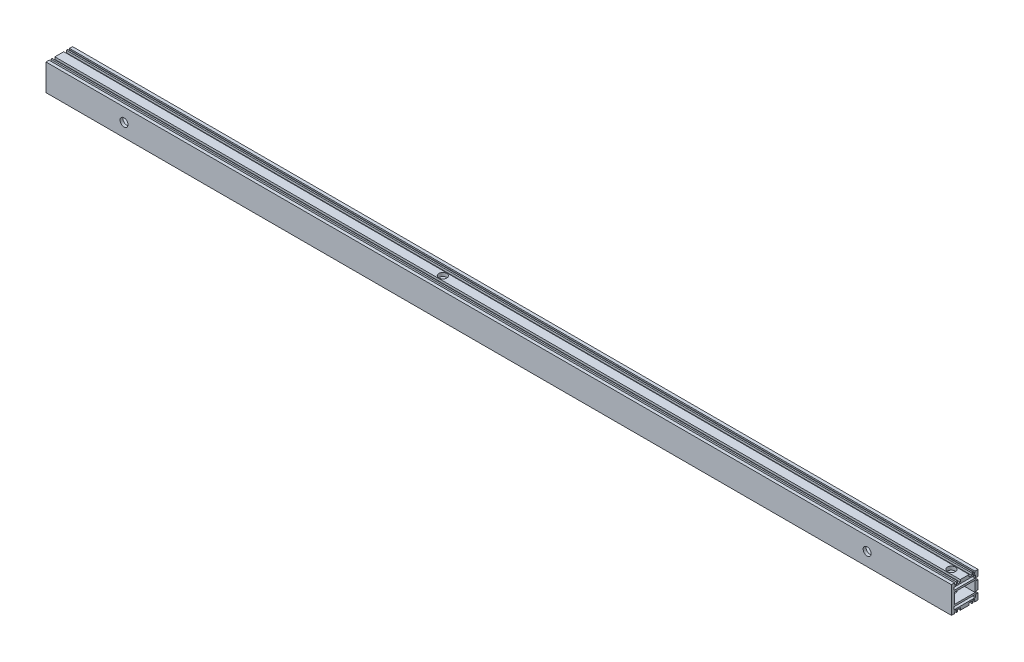
from build123d import *

# Parameters (mm, degrees)
SKETCH_1_W             = 23.5
SKETCH_1_H             = 12
EXTRUDE_1_DEPTH        = 510.5
HOLE_WIZARD_M6_1_D     = 5
HOLE_WIZARD_M6_1_DEPTH = 19
HOLE_WIZARD_M6_1_TIP   = 1.502151548
HOLE_WIZARD_M6_2_D     = 5
HOLE_WIZARD_M6_2_DEPTH = 19
HOLE_WIZARD_M6_2_TIP   = 1.502151548
HOLE_WIZARD_M6_3_D     = 5
HOLE_WIZARD_M6_3_DEPTH = 17
HOLE_WIZARD_M6_3_TIP   = 1.502151548
SKETCH_9_R             = 4.5
CUT_EXTRUDE_1_DEPTH    = 512.600674355
SKETCH_10_R            = 4.5
CUT_EXTRUDE_2_DEPTH    = 512.600674355
HOLE_WIZARD_M4_1_D     = 3.3
HOLE_WIZARD_M4_1_DEPTH = 11.5
HOLE_WIZARD_M4_1_TIP   = 0.991420021
HOLE_WIZARD_M4_2_D     = 3.3
HOLE_WIZARD_M4_2_DEPTH = 11.5
HOLE_WIZARD_M4_2_TIP   = 0.991420021


with BuildPart() as part:
    # 草图1 → 凸台-拉伸1 (new, symmetric)
    with BuildSketch(Plane(origin=(0, 0, 0), x_dir=(0, 0, -1), z_dir=(1, 0, 0))):
        Polygon((-11.5, 15), (-15, 15), (-15, -15), (-11.5, -15), (-11.5, -13.5), (-11, -13.5), (-11, -12), (-9.5, -12), (-9.5, -15), (-8, -15), (-8, -12.5), (-5, -12.5), (-5, -15), (5, -15), (5, -12.5), (8, -12.5), (8, -15), (9.5, -15), (9.5, -12), (11, -12), (11, -13.5), (11.5, -13.5), (11.5, -15), (15, -15), (15, -8), (12.5, -8), (12.5, -5), (15, -5), (15, 5), (12.5, 5), (12.5, 8), (15, 8), (15, 15), (11.5, 15), (11.5, 13.5), (11, 13.5), (11, 12), (9.5, 12), (9.5, 15), (8, 15), (8, 12.5), (5, 12.5), (5, 15), (-5, 15), (-5, 12.5), (-8, 12.5), (-8, 15), (-9.5, 15), (-9.5, 12), (-11, 12), (-11, 13.5), (-11.5, 13.5), align=None)
        with BuildLine():
            Line((12, -8.5), (12, -10.5))
            ThreePointArc((12, -10.5), (11.853553391, -10.853553391), (11.5, -11))
            Line((11.5, -11), (-11.5, -11))
            ThreePointArc((-11.5, -11), (-11.853553391, -10.853553391), (-12, -10.5))
            Line((-12, -10.5), (-12, -8.5))
            ThreePointArc((-12, -8.5), (-11.853553391, -8.146446609), (-11.5, -8))
            Line((-11.5, -8), (11.5, -8))
            ThreePointArc((11.5, -8), (11.853553391, -8.146446609), (12, -8.5))
        make_face(mode=Mode.SUBTRACT)
        Rectangle(SKETCH_1_W, SKETCH_1_H, mode=Mode.SUBTRACT)
        with BuildLine():
            ThreePointArc((-12, 10.5), (-11.853553391, 10.853553391), (-11.5, 11))
            Line((-11.5, 11), (11.5, 11))
            ThreePointArc((11.5, 11), (11.853553391, 10.853553391), (12, 10.5))
            Line((12, 10.5), (12, 8.5))
            ThreePointArc((12, 8.5), (11.853553391, 8.146446609), (11.5, 8))
            Line((11.5, 8), (-11.5, 8))
            ThreePointArc((-11.5, 8), (-11.853553391, 8.146446609), (-12, 8.5))
            Line((-12, 8.5), (-12, 10.5))
        make_face(mode=Mode.SUBTRACT)
    extrude(amount=EXTRUDE_1_DEPTH, both=True)

    # M6 螺纹孔1
    with Locations(Plane(origin=(0, -15, 0), x_dir=(-1, 0, 0), z_dir=(0, -1, 0))):
        with Locations((-460.5, 0), (-445.5, 0), (133, 0), (148, 0), (218, 0), (233, 0), (445.5, 0), (460.5, 0)):
            Hole(HOLE_WIZARD_M6_1_D / 2, depth=HOLE_WIZARD_M6_1_DEPTH)
            with Locations((0, 0, -(HOLE_WIZARD_M6_1_DEPTH + HOLE_WIZARD_M6_1_TIP / 2))):  # 118° drill point
                Cone(0, HOLE_WIZARD_M6_1_D / 2, HOLE_WIZARD_M6_1_TIP, mode=Mode.SUBTRACT)

    # M6 螺纹孔2
    with Locations(Plane(origin=(0, 0, -15), x_dir=(-1, 0, 0), z_dir=(0, 0, -1))):
        with Locations((460.5, 0), (445.5, 0), (-142.5, 0), (-157.5, 0), (-445.5, 0), (-460.5, 0), (380.5, 0)):
            Hole(HOLE_WIZARD_M6_2_D / 2, depth=HOLE_WIZARD_M6_2_DEPTH)
            with Locations((0, 0, -(HOLE_WIZARD_M6_2_DEPTH + HOLE_WIZARD_M6_2_TIP / 2))):  # 118° drill point
                Cone(0, HOLE_WIZARD_M6_2_D / 2, HOLE_WIZARD_M6_2_TIP, mode=Mode.SUBTRACT)

    # M6 螺纹孔3
    with Locations(Plane(origin=(0, -15, 0), x_dir=(-1, 0, 0), z_dir=(0, -1, 0))):
        with Locations((-262.5, 0), (-211.5, 0), (-160.5, 0)):
            Hole(HOLE_WIZARD_M6_3_D / 2, depth=HOLE_WIZARD_M6_3_DEPTH)
            with Locations((0, 0, -(HOLE_WIZARD_M6_3_DEPTH + HOLE_WIZARD_M6_3_TIP / 2))):  # 118° drill point
                Cone(0, HOLE_WIZARD_M6_3_D / 2, HOLE_WIZARD_M6_3_TIP, mode=Mode.SUBTRACT)

    # 草图9 → 切除-拉伸1 (cut, through all)
    with BuildSketch(Plane.XY.offset(15)):
        with Locations((415.5, 0)):
            Circle(SKETCH_9_R)
        with Locations((-422.5, 0)):
            Circle(SKETCH_9_R)
    extrude(amount=-CUT_EXTRUDE_1_DEPTH, mode=Mode.SUBTRACT)

    # 草图10 → 切除-拉伸2 (cut, through all)
    with BuildSketch(Plane(origin=(0, 15, 0), x_dir=(1, 0, 0), z_dir=(0, 1, 0))):
        with Locations((495.5, 0)):
            Circle(SKETCH_10_R)
        with Locations((-78, 0)):
            Circle(SKETCH_10_R)
    extrude(amount=-CUT_EXTRUDE_2_DEPTH, mode=Mode.SUBTRACT)

    # M4 螺纹孔1
    with Locations(Plane(origin=(0, 0, -15), x_dir=(-1, 0, 0), z_dir=(0, 0, -1))):
        with Locations((-429.5, 0), (-401.5, 0)):
            Hole(HOLE_WIZARD_M4_1_D / 2, depth=HOLE_WIZARD_M4_1_DEPTH)
            with Locations((0, 0, -(HOLE_WIZARD_M4_1_DEPTH + HOLE_WIZARD_M4_1_TIP / 2))):  # 118° drill point
                Cone(0, HOLE_WIZARD_M4_1_D / 2, HOLE_WIZARD_M4_1_TIP, mode=Mode.SUBTRACT)

    # M4 螺纹孔2
    with Locations(Plane(origin=(0, 0, -15), x_dir=(-1, 0, 0), z_dir=(0, 0, -1))):
        with Locations((-343.5, 0)):
            Hole(HOLE_WIZARD_M4_2_D / 2, depth=HOLE_WIZARD_M4_2_DEPTH)
            with Locations((0, 0, -(HOLE_WIZARD_M4_2_DEPTH + HOLE_WIZARD_M4_2_TIP / 2))):  # 118° drill point
                Cone(0, HOLE_WIZARD_M4_2_D / 2, HOLE_WIZARD_M4_2_TIP, mode=Mode.SUBTRACT)


solid = part.part
